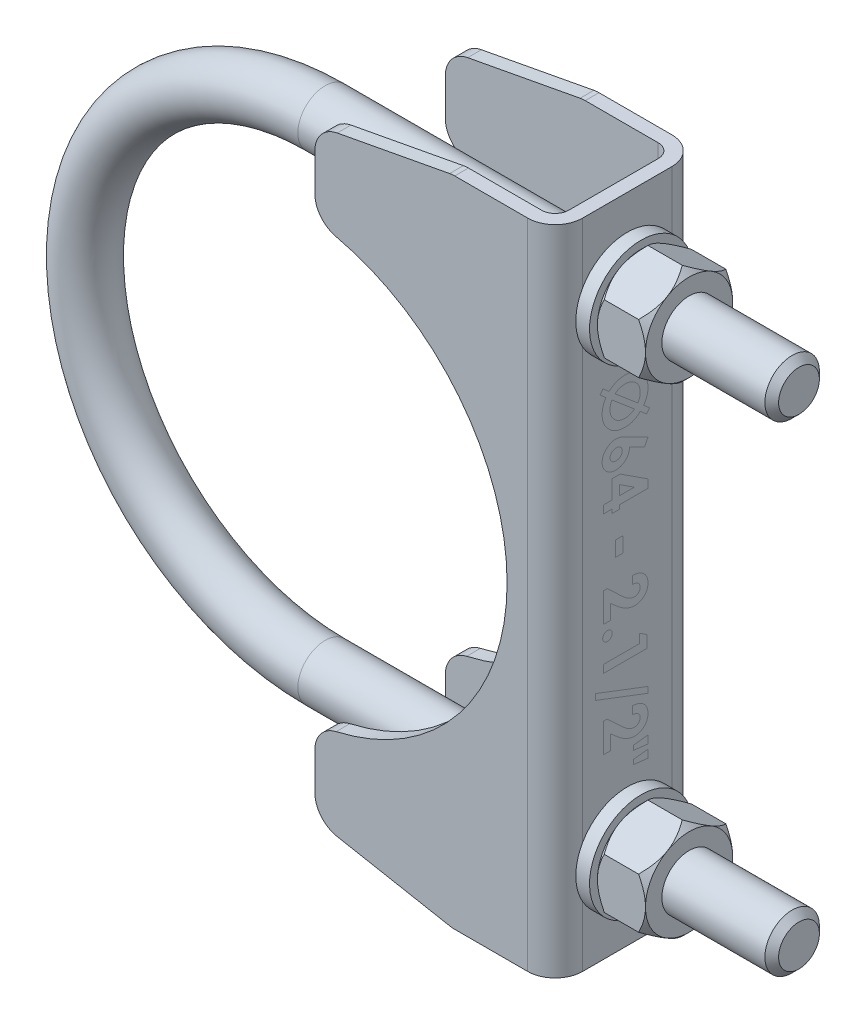
from build123d import *

# Parameters (mm, degrees)
ESBO_O2_R                = 3.96875
CHANFRO1_SIZE            = 1
ESBO_O3_W                = 21
ESBO_O3_H                = 95
RESSALTO_EXTRUS_O1_DEPTH = 2
RESSALTO_EXTRUS_O2_DEPTH = 2
FILETE1_R                = 2
FILETE2_R                = 4
ESBO_O5_R                = 7.5
ESBO_O5_R_2              = 5
RESSALTO_EXTRUS_O3_DEPTH = 2
RESSALTO_EXTRUS_O4_DEPTH = 7


with BuildPart() as part:
    # Varredura1: sweep along a path in Esboço1
    with BuildLine(Plane.XY) as varredura1_path:
        Line((0, 0), (-69, 0))
        ThreePointArc((-69, 0), (-103.96875, 34.96875), (-69, 69.9375))
        Line((-69, 69.9375), (0, 69.9375))
    # Esboço2 → Varredura1 (sweep)
    with BuildSketch(Plane(origin=(0, 0, 0), x_dir=(0, 0, -1), z_dir=(1, 0, 0))):
        Circle(ESBO_O2_R)
    sweep(path=varredura1_path.line)

    # Chanfro1
    chanfro1_edges = [part.edges().sort_by_distance(p)[0] for p in [
        (0, 0, 3.96875),
        (0, 69.9375, 3.96875),
    ]]
    chamfer(chanfro1_edges, length=CHANFRO1_SIZE)



with BuildPart() as body_2:
    # Esboço3 → Ressalto-extrusão1 (new body)
    with BuildSketch(Plane(origin=(-25, 0, 0), x_dir=(0, 0, -1), z_dir=(1, 0, 0))):
        with Locations((0, 34.96875)):
            Rectangle(ESBO_O3_W, ESBO_O3_H)
        with BuildLine():
            Line((4.25, 71.6875), (4.25, 68.1875))
            ThreePointArc((4.25, 68.1875), (0, 63.9375), (-4.25, 68.1875))
            Line((-4.25, 68.1875), (-4.25, 71.6875))
            ThreePointArc((-4.25, 71.6875), (0, 75.9375), (4.25, 71.6875))
        make_face(mode=Mode.SUBTRACT)
        with BuildLine():
            Line((-4.25, -1.75), (-4.25, 1.75))
            ThreePointArc((-4.25, 1.75), (0, 6), (4.25, 1.75))
            Line((4.25, 1.75), (4.25, -1.75))
            ThreePointArc((4.25, -1.75), (0, -6), (-4.25, -1.75))
        make_face(mode=Mode.SUBTRACT)
    extrude(amount=-RESSALTO_EXTRUS_O1_DEPTH)

    # Esboço4 → Ressalto-extrusão2 (add)
    with BuildSketch(Plane.XY.offset(10.5)):
        with BuildLine():
            Line((-27, 82.46875), (-27, -12.53125))
            Line((-27, -12.53125), (-40, -12.53125))
            Line((-40, -12.53125), (-60, -8.780265733))
            Line((-60, -8.780265733), (-60, 3.219734267))
            ThreePointArc((-60, 3.219734267), (-32, 34.96875), (-60, 66.717765733))
            Line((-60, 66.717765733), (-60, 78.717765733))
            Line((-60, 78.717765733), (-40, 82.46875))
            Line((-40, 82.46875), (-27, 82.46875))
        make_face()
    ressalto_extrus_o2 = extrude(amount=-RESSALTO_EXTRUS_O2_DEPTH)

    # Espelhar1: Ressalto-extrusão2 across plane
    add(ressalto_extrus_o2.mirror(Plane.XY))

    # Filete1
    filete1_edges = [body_2.edges().sort_by_distance(p)[0] for p in [
        (-27, 34.96875, 8.5),
        (-27, 34.96875, -8.5),
    ]]
    fillet(filete1_edges, radius=FILETE1_R)

    # Filete2
    filete2_edges = [body_2.edges().sort_by_distance(p)[0] for p in [
        (-60, 66.717765733, -9.5),
        (-60, 78.717765733, -9.5),
        (-60, 3.219734267, -9.5),
        (-60, -8.780265733, -9.5),
        (-60, -8.780265733, 9.5),
        (-60, 3.219734267, 9.5),
        (-60, 66.717765733, 9.5),
        (-60, 78.717765733, 9.5),
        (-40, 82.46875, 9.5),
        (-40, 82.46875, -9.5),
        (-25, 34.96875, -10.5),
        (-25, 34.96875, 10.5),
    ]]
    fillet(filete2_edges, radius=FILETE2_R)

    # Esboço5 → Ressalto-extrusão3 (add)
    # profile 1 of 2: a face of its own
    with BuildSketch(Plane(origin=(-25, 0, 0), x_dir=(0, 0, -1), z_dir=(1, 0, 0))):
        with Locations((0, 69.9375)):
            Circle(ESBO_O5_R)
        with Locations((0, 69.9375)):
            Circle(ESBO_O5_R_2, mode=Mode.SUBTRACT)
    # profile 2 of 2: a face of its own
    with BuildSketch(Plane(origin=(-25, 0, 0), x_dir=(0, 0, -1), z_dir=(1, 0, 0))):
        Circle(ESBO_O5_R)
        Circle(ESBO_O5_R_2, mode=Mode.SUBTRACT)
    extrude(amount=RESSALTO_EXTRUS_O3_DEPTH)


with BuildPart() as part_1:
    add(part.part)

    add(body_2.part)  # Ressalto-extrusão4 merges body 2
    # Esboço6 → Ressalto-extrusão4 (add)
    with BuildSketch(Plane(origin=(-23, 0, 0), x_dir=(0, 0, -1), z_dir=(1, 0, 0))):
        Polygon((-6.35, 73.603674209), (-6.35, 66.271325791), (0, 62.605151581), (6.35, 66.271325791), (6.35, 73.603674209), (0, 77.269848419), align=None)
        Polygon((6.35, 3.666174209), (0, 7.332348419), (-6.35, 3.666174209), (-6.35, -3.666174209), (0, -7.332348419), (6.35, -3.666174209), align=None)
    extrude(amount=RESSALTO_EXTRUS_O4_DEPTH)

    # Esboço7 → Corte-Revolução1 (revolve, cut)
    with BuildSketch(Plane.XY):
        Polygon((-16, 76.2875), (-16, 77.269848419), (-17, 77.269848419), align=None)
        Polygon((-23, 76.2875), (-23, 77.269848419), (-22, 77.269848419), align=None)
    revolve(axis=Axis((0, 69.9375, 0), (-1, 0, 0)), mode=Mode.SUBTRACT)

    # Esboço8 → Corte-Revolução2 (revolve, cut)
    with BuildSketch(Plane.XY):
        Polygon((-16, 7.332348419), (-17, 7.332348419), (-16, 6.35), align=None)
        Polygon((-23, 6.35), (-23, 7.332348419), (-22, 7.332348419), align=None)
    revolve(axis=Axis((0, 0, 0), (-1, 0, 0)), mode=Mode.SUBTRACT)


solid = part_1.part
